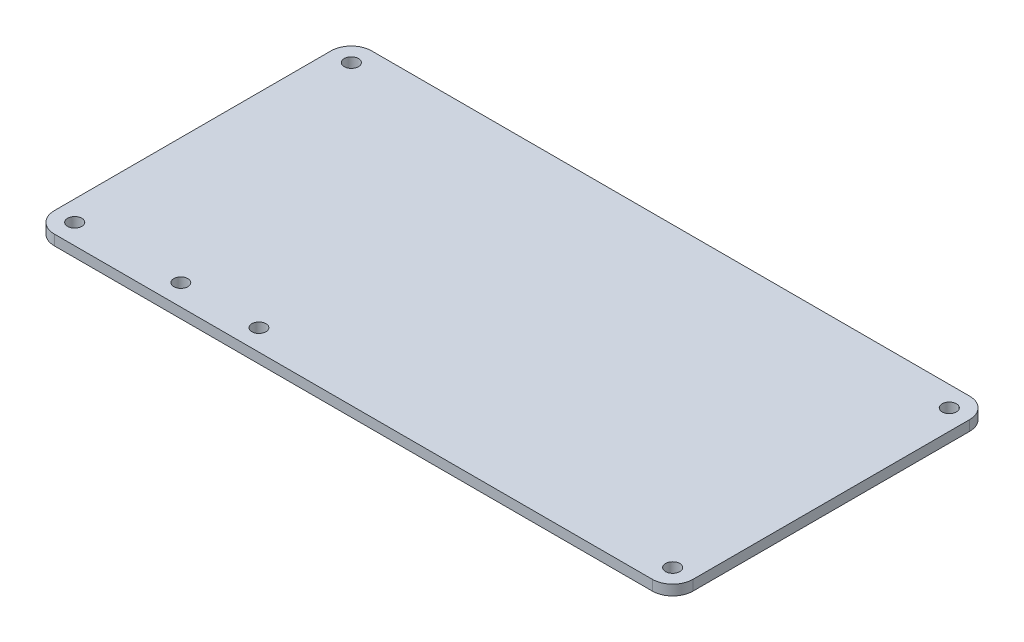
from build123d import *

# Parameters (mm, degrees)
SKETCH1_R           = 1.11125
BOSS_EXTRUDE1_DEPTH = 1.6
SKETCH2_R           = 1.1
CUT_EXTRUDE1_DEPTH  = 112.332268121


with BuildPart() as part:
    # Sketch1 → Boss-Extrude1 (new body)
    with BuildSketch(Plane(origin=(0, 0, 0), x_dir=(1, 0, 0), z_dir=(0, 1, 0))):
        with BuildLine():
            Line((3.175, 0), (96.52, 0))
            ThreePointArc((96.52, 0), (98.76506403, 0.92993597), (99.695, 3.175))
            Line((99.695, 3.175), (99.695, 46.355))
            ThreePointArc((99.695, 46.355), (98.76506403, 48.60006403), (96.52, 49.53))
            Line((96.52, 49.53), (3.175, 49.53))
            ThreePointArc((3.175, 49.53), (0.92993597, 48.60006403), (0, 46.355))
            Line((0, 46.355), (0, 3.175))
            ThreePointArc((0, 3.175), (0.92993597, 0.92993597), (3.175, 0))
        make_face()
        with Locations((3.175, 46.355)):
            Circle(SKETCH1_R, mode=Mode.SUBTRACT)
        with Locations((96.52, 46.355)):
            Circle(SKETCH1_R, mode=Mode.SUBTRACT)
        with Locations((96.52, 3.175)):
            Circle(SKETCH1_R, mode=Mode.SUBTRACT)
        with Locations((3.175, 3.175)):
            Circle(SKETCH1_R, mode=Mode.SUBTRACT)
    extrude(amount=BOSS_EXTRUDE1_DEPTH)

    # Sketch2 → Cut-Extrude1 (cut, through all)
    with BuildSketch(Plane(origin=(0, 1.6, 0), x_dir=(1, 0, 0), z_dir=(0, 1, 0))):
        with Locations((19.6125, 3.302)):
            Circle(SKETCH2_R)
        with Locations((31.8025, 3.302)):
            Circle(SKETCH2_R)
    extrude(amount=-CUT_EXTRUDE1_DEPTH, mode=Mode.SUBTRACT)


solid = part.part
